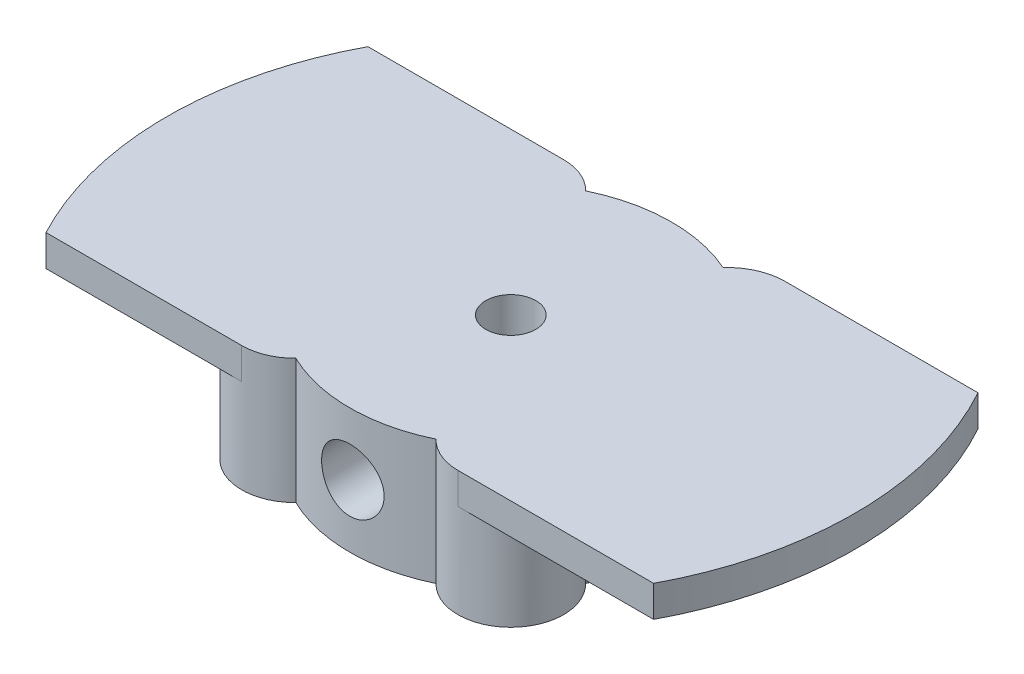
from build123d import *

# Parameters (mm, degrees)
SKETCH1_R           = 1.6
BOSS_EXTRUDE1_DEPTH = 8
SKETCH3_R           = 2
CUT_EXTRUDE1_DEPTH  = 14.5
BOSS_EXTRUDE3_START = -2
BOSS_EXTRUDE3_DEPTH = 2
SKETCH5_R           = 2.25
CUT_EXTRUDE2_DEPTH  = 6.3


with BuildPart() as part:
    # Sketch1 → Boss-Extrude1 (new body)
    with BuildSketch(Plane(origin=(0, 0, 0), x_dir=(1, 0, 0), z_dir=(0, 1, 0))):
        with BuildLine():
            ThreePointArc((-9.272031939, -4.485468061), (-9.308556454, -9.308556454), (-4.485468061, -9.272031939))
            ThreePointArc((-4.485468061, -9.272031939), (0, -10.3), (4.485468061, -9.272031939))
            ThreePointArc((4.485468061, -9.272031939), (9.308556454, -9.308556454), (9.272031939, -4.485468061))
            ThreePointArc((9.272031939, -4.485468061), (10.298455819, -0.178347233), (9.421782939, 4.161731161))
            ThreePointArc((9.421782939, 4.161731161), (9.547911886, 9.547911886), (4.161731161, 9.421782939))
            ThreePointArc((4.161731161, 9.421782939), (-0.178347233, 10.298455819), (-4.485468061, 9.272031939))
            ThreePointArc((-4.485468061, 9.272031939), (-9.308556454, 9.308556454), (-9.272031939, 4.485468061))
            ThreePointArc((-9.272031939, 4.485468061), (-10.3, 0), (-9.272031939, -4.485468061))
        make_face()
        Circle(SKETCH1_R, mode=Mode.SUBTRACT)
    extrude(amount=BOSS_EXTRUDE1_DEPTH)

    # Sketch3 → Cut-Extrude1 (cut)
    with BuildSketch(Plane.XY):
        with Locations((0, 4)):
            Circle(SKETCH3_R)
    extrude(amount=CUT_EXTRUDE1_DEPTH, mode=Mode.SUBTRACT)

    # Sketch4 → Boss-Extrude3 (add)
    with BuildSketch(Plane(origin=(0, 8, 0), x_dir=(1, 0, 0), z_dir=(0, 1, 0)).offset(BOSS_EXTRUDE3_START)):
        with BuildLine():
            Line((-19.439907407, 10.3), (-6.915, 10.3))
            ThreePointArc((-6.915, 10.3), (-10.052052009, 8.186664144), (-9.272031939, 4.485468061))
            ThreePointArc((-9.272031939, 4.485468061), (-10.3, 0), (-9.272031939, -4.485468061))
            ThreePointArc((-9.272031939, -4.485468061), (-10.052052009, -8.186664144), (-6.915, -10.3))
            Line((-6.915, -10.3), (-19.439907407, -10.3))
            ThreePointArc((-19.439907407, -10.3), (-22, 0), (-19.439907407, 10.3))
        make_face()
        with BuildLine():
            Line((19.256747497, 10.638499698), (6.915, 10.638499698))
            ThreePointArc((6.915, 10.638499698), (10.387480791, 8.25899671), (9.421782939, 4.161731161))
            ThreePointArc((9.421782939, 4.161731161), (10.298455819, -0.178347233), (9.272031939, -4.485468061))
            ThreePointArc((9.272031939, -4.485468061), (10.052052009, -8.186664144), (6.915, -10.3))
            Line((6.915, -10.3), (19.439907407, -10.3))
            ThreePointArc((19.439907407, -10.3), (21.999158338, 0.192438041), (19.256747497, 10.638499698))
        make_face()
    extrude(amount=BOSS_EXTRUDE3_DEPTH)

    # Sketch5 → Cut-Extrude2 (cut)
    with BuildSketch(Plane.XZ):
        with Locations((-6.915, 6.915)):
            Circle(SKETCH5_R)
        with Locations((6.915, 6.915)):
            Circle(SKETCH5_R)
        with Locations((6.915, -6.915)):
            Circle(SKETCH5_R)
        with Locations((-6.915, -6.915)):
            Circle(SKETCH5_R)
    extrude(amount=-CUT_EXTRUDE2_DEPTH, mode=Mode.SUBTRACT)


solid = part.part
